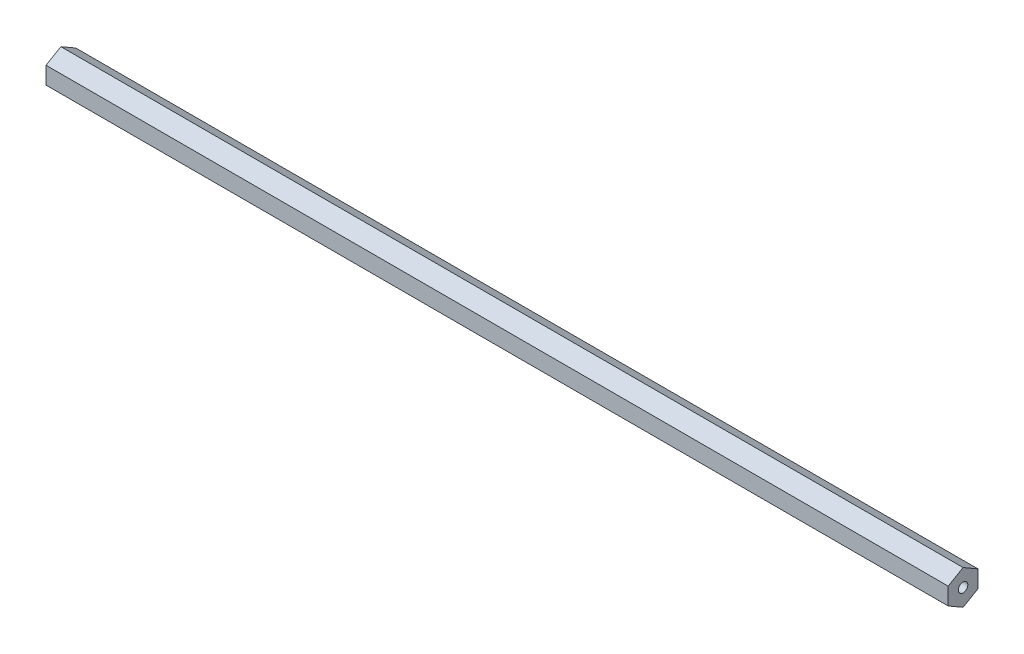
from build123d import *

# Parameters (mm, degrees)
BOSS_EXTRUDE1_DEPTH                  = 192.0875
F_10_32_TAPPED_HOLE2_D               = 4.0386
F_10_32_TAPPED_HOLE2_DEPTH           = 16.34744
F_10_32_TAPPED_HOLE2_TIP             = 1.213317848
F_10_32_TAPPED_HOLE2_ON_FACE_2_D     = 4.0386
F_10_32_TAPPED_HOLE2_ON_FACE_2_DEPTH = 16.34744
F_10_32_TAPPED_HOLE2_ON_FACE_2_TIP   = 1.213317848


with BuildPart() as part:
    # Sketch1 → Boss-Extrude1 (new, symmetric)
    with BuildSketch(Plane(origin=(0, 0, 0), x_dir=(0, 0, -1), z_dir=(1, 0, 0))):
        Polygon((6.35, 3.666174209), (0, 7.332348419), (-6.35, 3.666174209), (-6.35, -3.666174209), (0, -7.332348419), (6.35, -3.666174209), align=None)
    extrude(amount=BOSS_EXTRUDE1_DEPTH, both=True)

    # #10-32 Tapped Hole2
    with Locations(Plane(origin=(192.0875, 0, 0), x_dir=(0, 0, 1), z_dir=(1, 0, 0))):
        with Locations((0, 0)):
            Hole(F_10_32_TAPPED_HOLE2_D / 2, depth=F_10_32_TAPPED_HOLE2_DEPTH)
            with Locations((0, 0, -(F_10_32_TAPPED_HOLE2_DEPTH + F_10_32_TAPPED_HOLE2_TIP / 2))):  # 118° drill point
                Cone(0, F_10_32_TAPPED_HOLE2_D / 2, F_10_32_TAPPED_HOLE2_TIP, mode=Mode.SUBTRACT)

    # #10-32 Tapped Hole2 on face 2
    with Locations(Plane(origin=(-192.0875, 0, 0), x_dir=(0, 0, -1), z_dir=(-1, 0, 0))):
        with Locations((0, 0)):
            Hole(F_10_32_TAPPED_HOLE2_ON_FACE_2_D / 2, depth=F_10_32_TAPPED_HOLE2_ON_FACE_2_DEPTH)
            with Locations((0, 0, -(F_10_32_TAPPED_HOLE2_ON_FACE_2_DEPTH + F_10_32_TAPPED_HOLE2_ON_FACE_2_TIP / 2))):  # 118° drill point
                Cone(0, F_10_32_TAPPED_HOLE2_ON_FACE_2_D / 2, F_10_32_TAPPED_HOLE2_ON_FACE_2_TIP, mode=Mode.SUBTRACT)


solid = part.part
